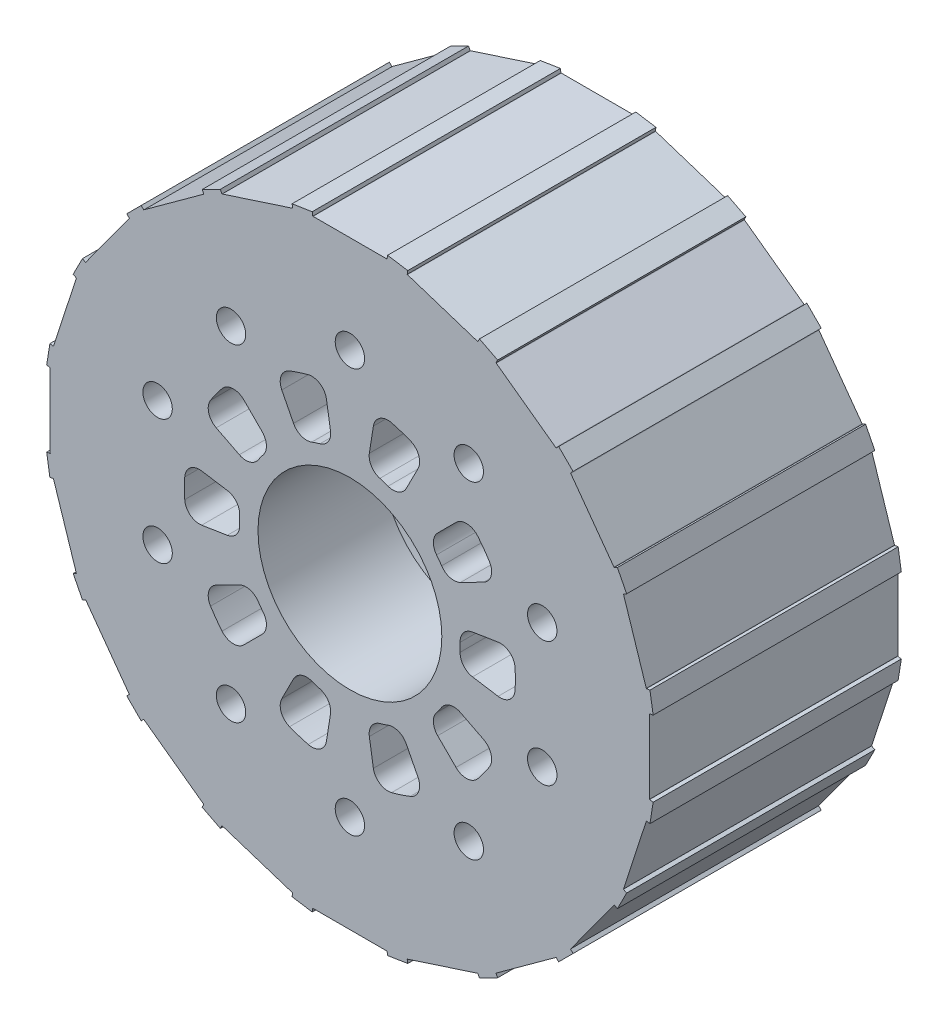
from build123d import *

# Parameters (mm, degrees)
BOSS_EXTRUDE1_DEPTH = 67.5
SKETCH2_R           = 68
CUT_EXTRUDE1_DEPTH  = 33.75
SKETCH3_R           = 4
CUT_EXTRUDE2_DEPTH  = 33.75
CUT_EXTRUDE3_DEPTH  = 33.75


with BuildPart() as part:
    # Sketch1 → Boss-Extrude1 (new body)
    with BuildSketch(Plane.XY):
        Polygon((10, 81.5), (0, 81.5), (-10, 81.5), (-10.098768834, 81.484356553), (-10.255203299, 82.472044894), (-15.73198551, 81.604607809), (-15.575551045, 80.616919468), (-15.674319879, 80.601276022), (-34.695450205, 74.420936134), (-34.784550857, 74.375537084), (-35.238541357, 75.266543609), (-40.179217965, 72.749143139), (-39.725227466, 71.858136614), (-39.814328118, 71.812737564), (-55.994668006, 60.057032519), (-56.065378684, 59.986321841), (-56.772485465, 60.693428622), (-60.693428622, 56.772485465), (-59.986321841, 56.065378684), (-60.057032519, 55.994668006), (-71.812737564, 39.814328118), (-71.858136614, 39.725227466), (-72.749143139, 40.179217965), (-75.266543609, 35.238541357), (-74.375537084, 34.784550857), (-74.420936134, 34.695450205), (-80.601276022, 15.674319879), (-80.616919468, 15.575551045), (-81.604607809, 15.73198551), (-82.472044894, 10.255203299), (-81.484356553, 10.098768834), (-81.5, 10), (-81.5, -10), (-81.484356553, -10.098768834), (-82.472044894, -10.255203299), (-81.604607809, -15.73198551), (-80.616919468, -15.575551045), (-80.601276022, -15.674319879), (-74.420936134, -34.695450205), (-74.375537084, -34.784550857), (-75.266543609, -35.238541357), (-72.749143139, -40.179217965), (-71.858136614, -39.725227466), (-71.812737564, -39.814328118), (-60.057032519, -55.994668006), (-59.986321841, -56.065378684), (-60.693428622, -56.772485465), (-56.772485465, -60.693428622), (-56.065378684, -59.986321841), (-55.994668006, -60.057032519), (-39.814328118, -71.812737564), (-39.725227466, -71.858136614), (-40.179217965, -72.749143139), (-35.238541357, -75.266543609), (-34.784550857, -74.375537084), (-34.695450205, -74.420936134), (-15.674319879, -80.601276022), (-15.575551045, -80.616919468), (-15.73198551, -81.604607809), (-10.255203299, -82.472044894), (-10.098768834, -81.484356553), (-10, -81.5), (10, -81.5), (10.098768834, -81.484356553), (10.255203299, -82.472044894), (15.73198551, -81.604607809), (15.575551045, -80.616919468), (15.674319879, -80.601276022), (34.695450205, -74.420936134), (34.784550857, -74.375537084), (35.238541357, -75.266543609), (40.179217965, -72.749143139), (39.725227466, -71.858136614), (39.814328118, -71.812737564), (55.994668006, -60.057032519), (56.065378684, -59.986321841), (56.772485465, -60.693428622), (60.693428622, -56.772485465), (59.986321841, -56.065378684), (60.057032519, -55.994668006), (71.812737564, -39.814328118), (71.858136614, -39.725227466), (72.749143139, -40.179217965), (75.266543609, -35.238541357), (74.375537084, -34.784550857), (74.420936134, -34.695450205), (80.601276022, -15.674319879), (80.616919468, -15.575551045), (81.604607809, -15.73198551), (82.472044894, -10.255203299), (81.484356554, -10.098768834), (81.5, -10), (81.5, 10), (81.484356553, 10.098768834), (82.472044894, 10.255203299), (81.604607809, 15.73198551), (80.616919468, 15.575551045), (80.601276022, 15.674319879), (74.420936134, 34.695450205), (74.375537084, 34.784550857), (75.266543609, 35.238541357), (72.749143139, 40.179217965), (71.858136614, 39.725227466), (71.812737564, 39.814328118), (60.057032519, 55.994668006), (59.986321841, 56.065378684), (60.693428622, 56.772485465), (56.772485465, 60.693428622), (56.065378684, 59.986321841), (55.994668006, 60.057032519), (39.814328118, 71.812737564), (39.725227466, 71.858136614), (40.179217965, 72.749143139), (35.238541357, 75.266543609), (34.784550857, 74.375537084), (34.695450205, 74.420936134), (15.674319879, 80.601276022), (15.575551045, 80.616919468), (15.73198551, 81.604607809), (10.255203299, 82.472044894), (10.098768834, 81.484356553), align=None)
        with BuildLine():
            ThreePointArc((25, 0), (-17.67766953, -17.67766953), (0, 25))
            ThreePointArc((0, 25), (17.67766953, 17.67766953), (25, 0))
        make_face(mode=Mode.SUBTRACT)
    extrude(amount=BOSS_EXTRUDE1_DEPTH)

    # Sketch2 → Cut-Extrude1 (cut)
    with BuildSketch(Plane(origin=(0, 0, 0), x_dir=(-1, 0, 0), z_dir=(0, 0, -1))):
        Circle(SKETCH2_R)
    extrude(amount=-CUT_EXTRUDE1_DEPTH, mode=Mode.SUBTRACT)

    # Sketch3 → Cut-Extrude2 (cut)
    with BuildSketch(Plane(origin=(0, 0, 33.75), x_dir=(-1, 0, 0), z_dir=(0, 0, -1))):
        with Locations((0, 55)):
            Circle(SKETCH3_R)
        with Locations((32.328188876, 44.495934691)):
            Circle(SKETCH3_R)
        with Locations((52.308108396, 16.995934691)):
            Circle(SKETCH3_R)
        with Locations((52.308108396, -16.995934691)):
            Circle(SKETCH3_R)
        with Locations((32.328188876, -44.495934691)):
            Circle(SKETCH3_R)
        with Locations((0, -55)):
            Circle(SKETCH3_R)
        with Locations((-32.328188876, -44.495934691)):
            Circle(SKETCH3_R)
        with Locations((-52.308108396, -16.995934691)):
            Circle(SKETCH3_R)
        with Locations((-52.308108396, 16.995934691)):
            Circle(SKETCH3_R)
        with Locations((-32.328188876, 44.495934691)):
            Circle(SKETCH3_R)
    extrude(amount=-CUT_EXTRUDE2_DEPTH, mode=Mode.SUBTRACT)

    # Sketch4 → Cut-Extrude3 (cut)
    with BuildSketch(Plane(origin=(0, 0, 33.75), x_dir=(-1, 0, 0), z_dir=(0, 0, -1))):
        with BuildLine():
            Line((-5.281835449, 33.348196567), (-6.383216288, 40.302041509))
            ThreePointArc((-6.383216288, 40.302041509), (-8.14367989, 43.023336778), (-11.342161812, 43.547162542))
            ThreePointArc((-11.342161812, 43.547162542), (-13.905764747, 42.797543233), (-16.420378262, 41.897149995))
            ThreePointArc((-16.420378262, 41.897149995), (-18.700107434, 39.593345547), (-18.52481518, 36.356996886))
            Line((-18.52481518, 36.356996886), (-15.328483493, 30.083842737))
            ThreePointArc((-15.328483493, 30.083842737), (-13.222545057, 28.175025497), (-10.380403585, 28.146886531))
            ThreePointArc((-10.380403585, 28.146886531), (-9.270509831, 28.531695489), (-8.146401893, 28.872757683))
            ThreePointArc((-8.146401893, 28.872757683), (-5.86360081, 30.566091427), (-5.281835449, 33.348196567))
        make_face()
        with BuildLine():
            Line((15.328483493, 30.083842737), (18.52481518, 36.356996886))
            ThreePointArc((18.52481518, 36.356996886), (18.700107434, 39.593345547), (16.420378262, 41.897149995))
            ThreePointArc((16.420378262, 41.897149995), (13.905764747, 42.797543233), (11.342161812, 43.547162542))
            ThreePointArc((11.342161812, 43.547162542), (8.14367989, 43.023336778), (6.383216288, 40.302041509))
            Line((6.383216288, 40.302041509), (5.281835449, 33.348196567))
            ThreePointArc((5.281835449, 33.348196567), (5.86360081, 30.566091427), (8.146401893, 28.872757683))
            ThreePointArc((8.146401893, 28.872757683), (9.270509831, 28.531695489), (10.380403585, 28.146886531))
            ThreePointArc((10.380403585, 28.146886531), (13.222545057, 28.175025497), (15.328483493, 30.083842737))
        make_face()
        with BuildLine():
            Line((30.083842737, 15.328483493), (36.356996886, 18.52481518))
            ThreePointArc((36.356996886, 18.52481518), (38.401089313, 21.040042045), (37.910891949, 24.243850182))
            ThreePointArc((37.910891949, 24.243850182), (36.405764747, 26.450336353), (34.77238158, 28.563639111))
            ThreePointArc((34.77238158, 28.563639111), (31.87685829, 30.019875669), (28.853076093, 28.853076093))
            Line((28.853076093, 28.853076093), (23.874672773, 23.874672773))
            ThreePointArc((23.874672773, 23.874672773), (22.710050465, 21.281949334), (23.561558733, 18.570216748))
            ThreePointArc((23.561558733, 18.570216748), (24.270509831, 17.633557569), (24.94224771, 16.669861403))
            ThreePointArc((24.94224771, 16.669861403), (27.25812813, 15.022057462), (30.083842737, 15.328483493))
        make_face()
        with BuildLine():
            Line((33.348196567, -5.281835449), (40.302041509, -6.383216288))
            ThreePointArc((40.302041509, -6.383216288), (43.434160278, -5.549842393), (44.920733454, -2.669776382))
            ThreePointArc((44.920733454, -2.669776382), (45, 0), (44.920733454, 2.669776382))
            ThreePointArc((44.920733454, 2.669776382), (43.434160278, 5.549842393), (40.302041509, 6.383216288))
            Line((40.302041509, 6.383216288), (33.348196567, 5.281835449))
            ThreePointArc((33.348196567, 5.281835449), (30.882032728, 3.868825943), (29.977000965, 1.174484194))
            ThreePointArc((29.977000965, 1.174484194), (30, 0), (29.977000965, -1.174484194))
            ThreePointArc((29.977000965, -1.174484194), (30.882032728, -3.868825943), (33.348196567, -5.281835449))
        make_face()
        with BuildLine():
            Line((23.874672773, -23.874672773), (28.853076093, -28.853076093))
            ThreePointArc((28.853076093, -28.853076093), (31.87685829, -30.019875669), (34.77238158, -28.563639111))
            ThreePointArc((34.77238158, -28.563639111), (36.405764747, -26.450336353), (37.910891949, -24.243850182))
            ThreePointArc((37.910891949, -24.243850182), (38.401089313, -21.040042045), (36.356996886, -18.52481518))
            Line((36.356996886, -18.52481518), (30.083842737, -15.328483493))
            ThreePointArc((30.083842737, -15.328483493), (27.25812813, -15.022057462), (24.94224771, -16.669861403))
            ThreePointArc((24.94224771, -16.669861403), (24.270509831, -17.633557569), (23.561558733, -18.570216748))
            ThreePointArc((23.561558733, -18.570216748), (22.710050465, -21.281949334), (23.874672773, -23.874672773))
        make_face()
        with BuildLine():
            Line((5.281835449, -33.348196567), (6.383216288, -40.302041509))
            ThreePointArc((6.383216288, -40.302041509), (8.14367989, -43.023336778), (11.342161812, -43.547162542))
            ThreePointArc((11.342161812, -43.547162542), (13.905764747, -42.797543233), (16.420378262, -41.897149995))
            ThreePointArc((16.420378262, -41.897149995), (18.700107434, -39.593345547), (18.52481518, -36.356996886))
            Line((18.52481518, -36.356996886), (15.328483493, -30.083842737))
            ThreePointArc((15.328483493, -30.083842737), (13.222545057, -28.175025497), (10.380403585, -28.146886531))
            ThreePointArc((10.380403585, -28.146886531), (9.270509831, -28.531695489), (8.146401893, -28.872757683))
            ThreePointArc((8.146401893, -28.872757683), (5.86360081, -30.566091427), (5.281835449, -33.348196567))
        make_face()
        with BuildLine():
            Line((-15.328483493, -30.083842737), (-18.52481518, -36.356996886))
            ThreePointArc((-18.52481518, -36.356996886), (-18.700107434, -39.593345547), (-16.420378262, -41.897149995))
            ThreePointArc((-16.420378262, -41.897149995), (-13.905764747, -42.797543233), (-11.342161812, -43.547162542))
            ThreePointArc((-11.342161812, -43.547162542), (-8.14367989, -43.023336778), (-6.383216288, -40.302041509))
            Line((-6.383216288, -40.302041509), (-5.281835449, -33.348196567))
            ThreePointArc((-5.281835449, -33.348196567), (-5.86360081, -30.566091427), (-8.146401893, -28.872757683))
            ThreePointArc((-8.146401893, -28.872757683), (-9.270509831, -28.531695489), (-10.380403585, -28.146886531))
            ThreePointArc((-10.380403585, -28.146886531), (-13.222545057, -28.175025497), (-15.328483493, -30.083842737))
        make_face()
        with BuildLine():
            Line((-30.083842737, 15.328483493), (-36.356996886, 18.52481518))
            ThreePointArc((-36.356996886, 18.52481518), (-38.401089313, 21.040042045), (-37.910891949, 24.243850182))
            ThreePointArc((-37.910891949, 24.243850182), (-36.405764747, 26.450336353), (-34.77238158, 28.563639111))
            ThreePointArc((-34.77238158, 28.563639111), (-31.87685829, 30.019875669), (-28.853076093, 28.853076093))
            Line((-28.853076093, 28.853076093), (-23.874672773, 23.874672773))
            ThreePointArc((-23.874672773, 23.874672773), (-22.710050465, 21.281949334), (-23.561558733, 18.570216748))
            ThreePointArc((-23.561558733, 18.570216748), (-24.270509831, 17.633557569), (-24.94224771, 16.669861403))
            ThreePointArc((-24.94224771, 16.669861403), (-27.25812813, 15.022057462), (-30.083842737, 15.328483493))
        make_face()
        with BuildLine():
            Line((-30.083842737, -15.328483493), (-36.356996886, -18.52481518))
            ThreePointArc((-36.356996886, -18.52481518), (-38.401089313, -21.040042045), (-37.910891949, -24.243850182))
            ThreePointArc((-37.910891949, -24.243850182), (-36.405764747, -26.450336353), (-34.77238158, -28.563639111))
            ThreePointArc((-34.77238158, -28.563639111), (-31.87685829, -30.019875669), (-28.853076093, -28.853076093))
            Line((-28.853076093, -28.853076093), (-23.874672773, -23.874672773))
            ThreePointArc((-23.874672773, -23.874672773), (-22.710050465, -21.281949334), (-23.561558733, -18.570216748))
            ThreePointArc((-23.561558733, -18.570216748), (-24.270509831, -17.633557569), (-24.94224771, -16.669861403))
            ThreePointArc((-24.94224771, -16.669861403), (-27.25812813, -15.022057462), (-30.083842737, -15.328483493))
        make_face()
        with BuildLine():
            Line((-33.348196567, 5.281835449), (-40.302041509, 6.383216288))
            ThreePointArc((-40.302041509, 6.383216288), (-43.434160278, 5.549842393), (-44.920733454, 2.669776382))
            ThreePointArc((-44.920733454, 2.669776382), (-45, 0), (-44.920733454, -2.669776382))
            ThreePointArc((-44.920733454, -2.669776382), (-43.434160278, -5.549842393), (-40.302041509, -6.383216288))
            Line((-40.302041509, -6.383216288), (-33.348196567, -5.281835449))
            ThreePointArc((-33.348196567, -5.281835449), (-30.882032728, -3.868825943), (-29.977000965, -1.174484194))
            ThreePointArc((-29.977000965, -1.174484194), (-30, 0), (-29.977000965, 1.174484194))
            ThreePointArc((-29.977000965, 1.174484194), (-30.882032728, 3.868825943), (-33.348196567, 5.281835449))
        make_face()
    extrude(amount=-CUT_EXTRUDE3_DEPTH, mode=Mode.SUBTRACT)


solid = part.part
